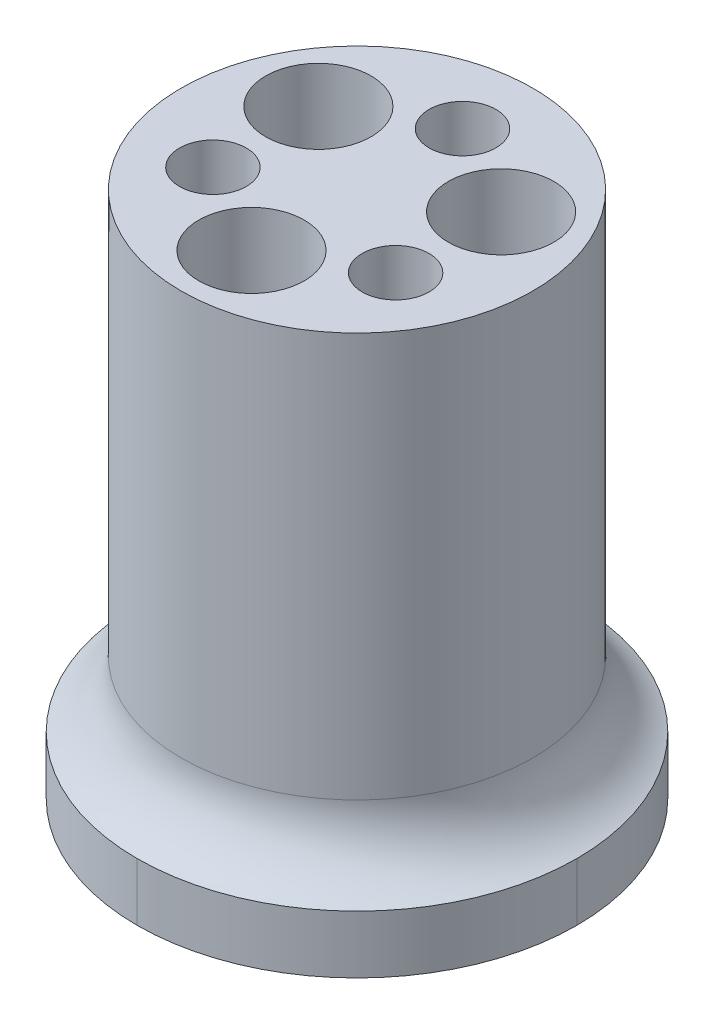
from build123d import *

# Parameters (mm, degrees)
SKETCH_1_R          = 10
EXTRUDE_1_DEPTH     = 30
SKETCH_2_R          = 1.85
CUT_EXTRUDE_1_DEPTH = 34.166247904
SKETCH_3_R          = 1.85
SKETCH_3_R_2        = 1.6
EXTRUDE_2_DEPTH     = 15
CUT_EXTRUDE_START   = -15
SKETCH_4_R          = 2.5
SKETCH_4_R_2        = 1.85
CUT_EXTRUDE_2_DEPTH = 15
EXTRUDE_START       = -15
SKETCH_5_R          = 1.85
SKETCH_5_R_2        = 1.6
EXTRUDE_3_DEPTH     = 15
SKETCH_6_R          = 2.5
CUT_EXTRUDE_4_DEPTH = 15
SKETCH_8_W          = 25
SKETCH_8_H          = 25
SKETCH_8_R          = 10
EXTRUDE_4_DEPTH     = 3
FILLET_1_R          = 4
FILLET_6_R          = 12.5
FILLET_7_R          = 12.5
FILLET_8_R          = 12.5
FILLET_9_R          = 12.5
EXTRUDE_START_2     = -25
SKETCH_9_R          = 2.5
EXTRUDE_6_DEPTH     = 25
SKETCH_10_R         = 1.9
CUT_EXTRUDE_5_DEPTH = 10
SKETCH_11_R         = 3
CUT_EXTRUDE_6_DEPTH = 15


# Some blends are built 0.0001 mm under size
with BuildPart() as part:
    # 草图1 → 凸台-拉伸1 (new body)
    with BuildSketch(Plane(origin=(0, 0, 0), x_dir=(1, 0, 0), z_dir=(0, 1, 0))):
        with Locations(Location((0, 0, 0), (0, 0, 270))):
            Circle(SKETCH_1_R)
    extrude(amount=EXTRUDE_1_DEPTH)

    # 草图2 → 切除-拉伸1 (cut, through all)
    with BuildSketch(Plane(origin=(0, 30, 0), x_dir=(1, 0, 0), z_dir=(0, 1, 0))):
        with Locations(Location((0, 6, 0), (0, 0, 270))):
            Circle(SKETCH_2_R)
        with Locations(Location((5.196152423, 3, 0), (0, 0, 270))):
            Circle(SKETCH_2_R)
        with Locations(Location((5.196152423, -3, 0), (0, 0, 270))):
            Circle(SKETCH_2_R)
        with Locations(Location((0, -6, 0), (0, 0, 270))):
            Circle(SKETCH_2_R)
        with Locations(Location((-5.196152423, -3, 0), (0, 0, 270))):
            Circle(SKETCH_2_R)
        with Locations(Location((-5.196152423, 3, 0), (0, 0, 270))):
            Circle(SKETCH_2_R)
    extrude(amount=-CUT_EXTRUDE_1_DEPTH, mode=Mode.SUBTRACT)

    # 草图3 → 凸台-拉伸2 (add)
    # profile 1 of 3: a face of its own
    with BuildSketch(Plane(origin=(0, 30, 0), x_dir=(1, 0, 0), z_dir=(0, 1, 0))):
        with Locations(Location((0, 6, 0), (0, 0, 270))):
            Circle(SKETCH_3_R)
        with Locations(Location((0, 6, 0), (0, 0, 270))):
            Circle(SKETCH_3_R_2, mode=Mode.SUBTRACT)
    # profile 2 of 3: a face of its own
    with BuildSketch(Plane(origin=(0, 30, 0), x_dir=(1, 0, 0), z_dir=(0, 1, 0))):
        with Locations(Location((-5.196152423, -3, 0), (0, 0, 270))):
            Circle(SKETCH_3_R)
        with Locations(Location((-5.196152423, -3, 0), (0, 0, 270))):
            Circle(SKETCH_3_R_2, mode=Mode.SUBTRACT)
    # profile 3 of 3: a face of its own
    with BuildSketch(Plane(origin=(0, 30, 0), x_dir=(1, 0, 0), z_dir=(0, 1, 0))):
        with Locations(Location((5.196152423, -3, 0), (0, 0, 270))):
            Circle(SKETCH_3_R)
        with Locations(Location((5.196152423, -3, 0), (0, 0, 270))):
            Circle(SKETCH_3_R_2, mode=Mode.SUBTRACT)
    extrude(amount=-EXTRUDE_2_DEPTH)

    # 草图4 → 切除-拉伸2 (cut)
    # profile 1 of 3: a face of its own
    with BuildSketch(Plane.XZ.offset(CUT_EXTRUDE_START)):
        with Locations(Location((-5.196152423, 3, 0), (0, 0, 270))):
            Circle(SKETCH_4_R)
        with Locations((-5.196152423, 3)):
            Circle(SKETCH_4_R_2, mode=Mode.SUBTRACT)
    # profile 2 of 3: a face of its own
    with BuildSketch(Plane.XZ.offset(CUT_EXTRUDE_START)):
        with Locations(Location((5.196152423, 3, 0), (0, 0, 270))):
            Circle(SKETCH_4_R)
        with Locations((5.196152423, 3)):
            Circle(SKETCH_4_R_2, mode=Mode.SUBTRACT)
    # profile 3 of 3: a face of its own
    with BuildSketch(Plane.XZ.offset(CUT_EXTRUDE_START)):
        with Locations(Location((0, -6, 0), (0, 0, 270))):
            Circle(SKETCH_4_R)
        with Locations((0, -6)):
            Circle(SKETCH_4_R_2, mode=Mode.SUBTRACT)
    extrude(amount=CUT_EXTRUDE_2_DEPTH, mode=Mode.SUBTRACT)

    # 草图5 → 凸台-拉伸3 (add)
    # profile 1 of 3: a face of its own
    with BuildSketch(Plane.XZ.offset(EXTRUDE_START)):
        with Locations(Location((0, 6, 0), (0, 0, 90))):
            Circle(SKETCH_5_R)
        with Locations(Location((0, 6, 0), (0, 0, 270))):
            Circle(SKETCH_5_R_2, mode=Mode.SUBTRACT)
    # profile 2 of 3: a face of its own
    with BuildSketch(Plane.XZ.offset(EXTRUDE_START)):
        with Locations(Location((-5.196152423, -3, 0), (0, 0, 90))):
            Circle(SKETCH_5_R)
        with Locations(Location((-5.196152423, -3, 0), (0, 0, 270))):
            Circle(SKETCH_5_R_2, mode=Mode.SUBTRACT)
    # profile 3 of 3: a face of its own
    with BuildSketch(Plane.XZ.offset(EXTRUDE_START)):
        with Locations(Location((5.196152423, -3, 0), (0, 0, 90))):
            Circle(SKETCH_5_R)
        with Locations(Location((5.196152423, -3, 0), (0, 0, 270))):
            Circle(SKETCH_5_R_2, mode=Mode.SUBTRACT)
    extrude(amount=EXTRUDE_3_DEPTH)

    # 草图6 → 切除-拉伸4 (cut)
    with BuildSketch(Plane(origin=(0, 30, 0), x_dir=(1, 0, 0), z_dir=(0, 1, 0))):
        with Locations(Location((-5.196152423, 3, 0), (0, 0, 270))):
            Circle(SKETCH_6_R)
        with Locations(Location((5.196152423, 3, 0), (0, 0, 270))):
            Circle(SKETCH_6_R)
        with Locations(Location((0, -6, 0), (0, 0, 270))):
            Circle(SKETCH_6_R)
    extrude(amount=-CUT_EXTRUDE_4_DEPTH, mode=Mode.SUBTRACT)

    # 草图8 → 凸台-拉伸4 (add)
    with BuildSketch(Plane.XZ):
        Rectangle(SKETCH_8_W, SKETCH_8_H)
        with Locations(Location((0, 0, 0), (0, 0, 270))):
            Circle(SKETCH_8_R, mode=Mode.SUBTRACT)
    extrude(amount=-EXTRUDE_4_DEPTH)

    # 圆角1
    # the kernel refuses this fillet: 4 mm, written as the material it adds along each edge
    with BuildSketch(Plane(origin=(0, 3, 0), x_dir=(0, 0, 1), z_dir=(-1, 0, 0))) as fillet_1_piece_1_section:
        with BuildLine():
            CenterArc((10 + FILLET_1_R, FILLET_1_R), FILLET_1_R, 180, 90)
            Line((10 + FILLET_1_R, 0), (10, 0))
            Line((10, 0), (10, FILLET_1_R))
        make_face()
    fillet_1_piece_1 = revolve(axis=Axis((0, 3, 0), (0, 1, 0)), mode=Mode.PRIVATE)
    fillet_1_piece_1 = split(fillet_1_piece_1, bisect_by=Plane(origin=(-12.5, 4.125745955, -11.125745955), z_dir=(1, 0, 0)), keep=Keep.TOP, mode=Mode.PRIVATE)
    fillet_1_piece_1 = split(fillet_1_piece_1, bisect_by=Plane(origin=(0, 4.125745955, 12.5), z_dir=(0, 0, -1)), keep=Keep.TOP, mode=Mode.PRIVATE)
    fillet_1_piece_1 = split(fillet_1_piece_1, bisect_by=Plane(origin=(12.5, 4.125745955, -11.125745955), z_dir=(-1, 0, 0)), keep=Keep.TOP, mode=Mode.PRIVATE)
    fillet_1_piece_1 = split(fillet_1_piece_1, bisect_by=Plane(origin=(0, 4.125745955, -12.5), z_dir=(0, 0, 1)), keep=Keep.TOP, mode=Mode.PRIVATE)
    add(fillet_1_piece_1)

    # 圆角6
    fillet_6_edges = [part.edges().sort_by_distance(p)[0] for p in [
        (12.5, 1.5, 12.5),
    ]]
    fillet(fillet_6_edges, radius=FILLET_6_R)

    # 圆角7
    fillet_7_edges = [part.edges().sort_by_distance(p)[0] for p in [
        (-12.5, 1.5, 12.5),
    ]]
    fillet(fillet_7_edges, radius=FILLET_7_R - 0.0001)  # a hair under: the kernel refuses the full size

    # 圆角8
    fillet_8_edges = [part.edges().sort_by_distance(p)[0] for p in [
        (-12.5, 1.5, -12.5),
    ]]
    fillet(fillet_8_edges, radius=FILLET_8_R)

    # 圆角9
    fillet_9_edges = [part.edges().sort_by_distance(p)[0] for p in [
        (12.5, 1.5, -12.5),
    ]]
    fillet(fillet_9_edges, radius=FILLET_9_R - 0.0001)  # a hair under: the kernel refuses the full size

    # 草图9 → 凸台-拉伸6 (add)
    with BuildSketch(Plane.XZ.offset(EXTRUDE_START_2)):
        with Locations((5.196152423, 3)):
            Circle(SKETCH_9_R)
        with Locations((-5.196152423, 3)):
            Circle(SKETCH_9_R)
        with Locations((0, -6)):
            Circle(SKETCH_9_R)
    extrude(amount=EXTRUDE_6_DEPTH)

    # 草图10 → 切除-拉伸5 (cut)
    with BuildSketch(Plane(origin=(0, 30, 0), x_dir=(1, 0, 0), z_dir=(0, 1, 0))):
        with Locations(Location((0, 6, 0), (0, 0, 270))):
            Circle(SKETCH_10_R)
        with Locations(Location((-5.196152423, -3, 0), (0, 0, 270))):
            Circle(SKETCH_10_R)
        with Locations(Location((5.196152423, -3, 0), (0, 0, 270))):
            Circle(SKETCH_10_R)
    extrude(amount=-CUT_EXTRUDE_5_DEPTH, mode=Mode.SUBTRACT)

    # 草图11 → 切除-拉伸6 (cut)
    with BuildSketch(Plane(origin=(0, 30, 0), x_dir=(1, 0, 0), z_dir=(0, 1, 0))):
        with Locations(Location((-5.196152423, 3, 0), (0, 0, 270))):
            Circle(SKETCH_11_R)
        with Locations(Location((5.196152423, 3, 0), (0, 0, 270))):
            Circle(SKETCH_11_R)
        with Locations(Location((0, -6, 0), (0, 0, 270))):
            Circle(SKETCH_11_R)
    extrude(amount=-CUT_EXTRUDE_6_DEPTH, mode=Mode.SUBTRACT)


solid = part.part
